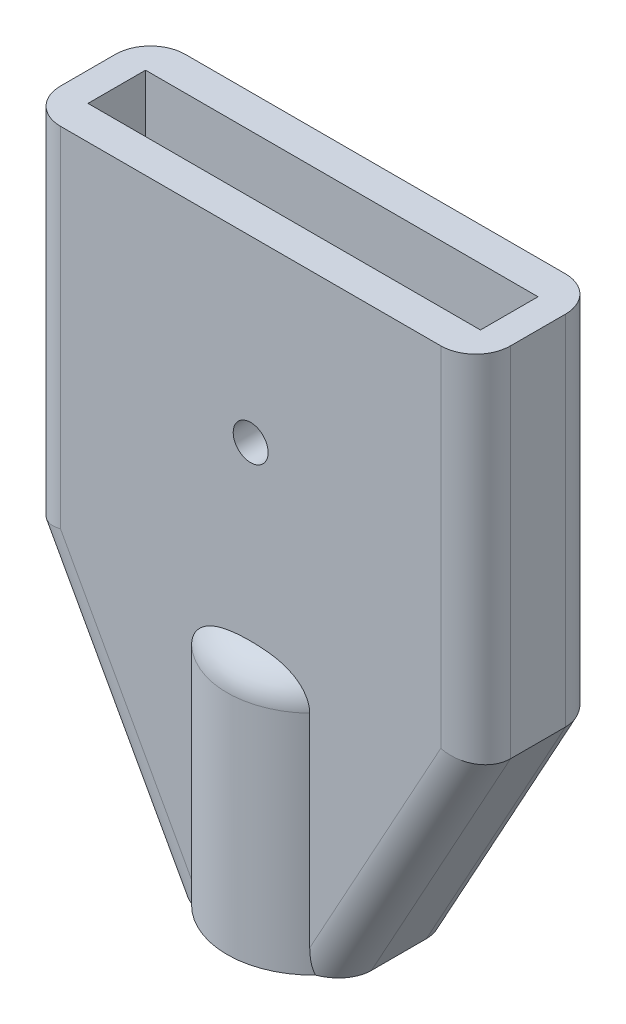
from build123d import *

# Parameters (mm, degrees)
BOSS_EXTRUDE1_DEPTH = 7.15
SKETCH3_R           = 4.925
BOSS_EXTRUDE2_DEPTH = 15
SKETCH4_R           = 2.925
CUT_EXTRUDE1_DEPTH  = 13.5
SKETCH5_W           = 22.5
SKETCH5_H           = 3.3
CUT_EXTRUDE2_DEPTH  = 18
SKETCH6_R           = 1
CUT_EXTRUDE3_DEPTH  = 45.304514443
FILLET1_R           = 2


with BuildPart() as part:
    # Sketch2 → Boss-Extrude1 (new body)
    with BuildSketch(Plane.XY):
        Polygon((7.975, 0), (17.825, 0), (25.8, 14.5), (25.8, 35), (0, 35), (0, 14.5), align=None)
    extrude(amount=BOSS_EXTRUDE1_DEPTH)

    # Sketch3 → Boss-Extrude2 (add)
    with BuildSketch(Plane.XZ):
        with Locations((12.9, 3.575)):
            Circle(SKETCH3_R)
    extrude(amount=-BOSS_EXTRUDE2_DEPTH)

    # Sketch4 → Cut-Extrude1 (cut)
    with BuildSketch(Plane.XZ):
        with Locations((12.9, 3.575)):
            Circle(SKETCH4_R)
    extrude(amount=-CUT_EXTRUDE1_DEPTH, mode=Mode.SUBTRACT)

    # Sketch5 → Cut-Extrude2 (cut)
    with BuildSketch(Plane(origin=(0, 35, 0), x_dir=(1, 0, 0), z_dir=(0, 1, 0))):
        with Locations((12.9, -3.575)):
            Rectangle(SKETCH5_W, SKETCH5_H)
    extrude(amount=-CUT_EXTRUDE2_DEPTH, mode=Mode.SUBTRACT)

    # Sketch6 → Cut-Extrude3 (cut, through all)
    with BuildSketch(Plane(origin=(0, 0, 0), x_dir=(-1, 0, 0), z_dir=(0, 0, -1))):
        with Locations((-12.9, 24.75)):
            Circle(SKETCH6_R)
    extrude(amount=-CUT_EXTRUDE3_DEPTH, mode=Mode.SUBTRACT)

    # Fillet1
    # the kernel refuses this fillet: 2 mm, written as the material it takes off along each edge
    with BuildSketch(Plane(origin=(12.9, 15, 3.575), x_dir=(0.9794089200895291, 0, -0.20188652072157354), z_dir=(-0.20188652072157354, 0, -0.9794089200895291))) as fillet1_piece_1_section:
        with BuildLine():
            CenterArc((4.925 - FILLET1_R, FILLET1_R), FILLET1_R, 270, 90)
            Line((4.925 - FILLET1_R, 0), (4.925, 0))
            Line((4.925, 0), (4.925, FILLET1_R))
        make_face()
    fillet1_piece_1 = revolve(axis=Axis((12.9, 15, 3.575), (0, -1, 0)), revolution_arc=203.294598703, mode=Mode.PRIVATE)
    fillet1_piece_1 = split(fillet1_piece_1, bisect_by=Plane(origin=(12.9, 14.171762317, 7.15), z_dir=(0, 0, 1)), keep=Keep.TOP, mode=Mode.PRIVATE)
    add(fillet1_piece_1, mode=Mode.SUBTRACT)
    with BuildSketch(Plane(origin=(12.9, 15, 3.575), x_dir=(-0.9794089200895291, 0, 0.20188652072157326), z_dir=(0.20188652072157326, 0, 0.9794089200895291))) as fillet1_piece_2_section:
        with BuildLine():
            CenterArc((4.925 - FILLET1_R, FILLET1_R), FILLET1_R, 270, 90)
            Line((4.925 - FILLET1_R, 0), (4.925, 0))
            Line((4.925, 0), (4.925, FILLET1_R))
        make_face()
    fillet1_piece_2 = revolve(axis=Axis((12.9, 15, 3.575), (0, -1, 0)), revolution_arc=203.294598703, mode=Mode.PRIVATE)
    fillet1_piece_2 = split(fillet1_piece_2, bisect_by=Plane(origin=(12.9, 14.171762317, 0), z_dir=(0, 0, -1)), keep=Keep.TOP, mode=Mode.PRIVATE)
    add(fillet1_piece_2, mode=Mode.SUBTRACT)
    with BuildSketch(Plane(origin=(-2.409593749, 18.881079543, 7.15), x_dir=(0, 0, -1), z_dir=(0.48191874977215604, -0.876215908676647, 0))) as fillet1_piece_3_section:
        with BuildLine():
            CenterArc((FILLET1_R, FILLET1_R), FILLET1_R, 180, 90)
            Line((0, FILLET1_R), (0, 0))
            Line((0, 0), (FILLET1_R, 0))
        make_face()
    fillet1_piece_3 = extrude(amount=26.548432705, mode=Mode.PRIVATE)
    fillet1_piece_3 = fillet1_piece_3 - Plane(origin=(12.9, 7.738737356, 3.575), x_dir=(1, 0, 0), z_dir=(0, -1, 0)) * Cylinder(4.925, 62, mode=Mode.PRIVATE)
    add(fillet1_piece_3, mode=Mode.SUBTRACT)
    with BuildSketch(Plane(origin=(-2.409593749, 18.881079543, 0), x_dir=(0.876215908676647, 0.48191874977215604, 0), z_dir=(0.48191874977215604, -0.876215908676647, 0))) as fillet1_piece_4_section:
        with BuildLine():
            CenterArc((FILLET1_R, FILLET1_R), FILLET1_R, 180, 90)
            Line((0, FILLET1_R), (0, 0))
            Line((0, 0), (FILLET1_R, 0))
        make_face()
    fillet1_piece_4 = extrude(amount=26.548432705, mode=Mode.PRIVATE)
    fillet1_piece_4 = fillet1_piece_4 - Plane(origin=(12.9, 7.738737334, 3.575), x_dir=(1, 0, 0), z_dir=(0, -1, 0)) * Cylinder(4.925, 62, mode=Mode.PRIVATE)
    add(fillet1_piece_4, mode=Mode.SUBTRACT)
    with BuildSketch(Plane(origin=(15.415406251, -4.381079543, 7.15), x_dir=(-0.8762159086766471, 0.4819187497721556, 0), z_dir=(0.48191874977215565, 0.8762159086766471, 0))) as fillet1_piece_5_section:
        with BuildLine():
            CenterArc((FILLET1_R, -FILLET1_R), FILLET1_R, 90, 90)
            Line((0, -FILLET1_R), (0, 0))
            Line((0, 0), (FILLET1_R, 0))
        make_face()
    fillet1_piece_5 = extrude(amount=26.548432705, mode=Mode.PRIVATE)
    fillet1_piece_5 = fillet1_piece_5 - Plane(origin=(12.9, 7.738737334, 3.575), x_dir=(1, 0, 0), z_dir=(0, -1, 0)) * Cylinder(4.925, 62, mode=Mode.PRIVATE)
    add(fillet1_piece_5, mode=Mode.SUBTRACT)
    with BuildSketch(Plane(origin=(15.415406251, -4.381079543, 0), x_dir=(-0.8762159086766471, 0.4819187497721556, 0), z_dir=(0.48191874977215565, 0.8762159086766471, 0))) as fillet1_piece_6_section:
        with BuildLine():
            CenterArc((FILLET1_R, FILLET1_R), FILLET1_R, 180, 90)
            Line((0, FILLET1_R), (0, 0))
            Line((0, 0), (FILLET1_R, 0))
        make_face()
    fillet1_piece_6 = extrude(amount=26.548432705, mode=Mode.PRIVATE)
    fillet1_piece_6 = fillet1_piece_6 - Plane(origin=(12.9, 7.738737305, 3.575), x_dir=(1, 0, 0), z_dir=(0, -1, 0)) * Cylinder(4.925, 62, mode=Mode.PRIVATE)
    add(fillet1_piece_6, mode=Mode.SUBTRACT)
    with BuildSketch(Plane(origin=(25.8, 9.5, 7.15), x_dir=(-1, 0, 0), z_dir=(0, 1, 0)), Plane(origin=(0, 40, 7.15), x_dir=(1, 0, 0), z_dir=(0, -1, 0))) as fillet1_piece_7:
        with BuildLine():
            CenterArc((FILLET1_R, -FILLET1_R), FILLET1_R, 90, 90)
            Line((0, -FILLET1_R), (0, 0))
            Line((0, 0), (FILLET1_R, 0))
        make_face()
    extrude(amount=30.5, mode=Mode.SUBTRACT)
    with BuildSketch(Plane(origin=(0, 40, 0), x_dir=(1, 0, 0), z_dir=(0, -1, 0)), Plane(origin=(25.8, 9.5, 0), x_dir=(-1, 0, 0), z_dir=(0, 1, 0))) as fillet1_piece_8:
        with BuildLine():
            CenterArc((FILLET1_R, FILLET1_R), FILLET1_R, 180, 90)
            Line((0, FILLET1_R), (0, 0))
            Line((0, 0), (FILLET1_R, 0))
        make_face()
    extrude(amount=30.5, mode=Mode.SUBTRACT)


solid = part.part
